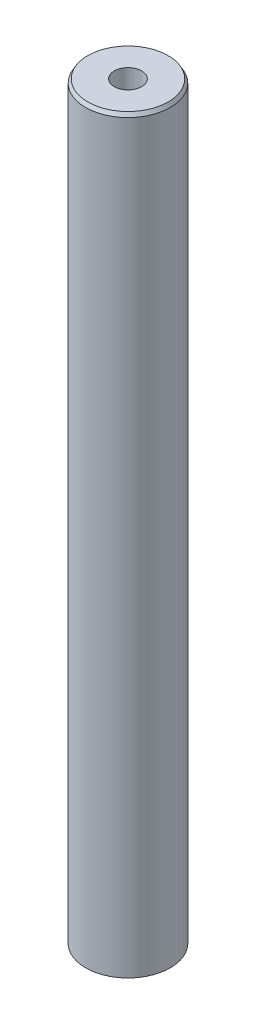
from build123d import *
from OCP.BRepFilletAPI import BRepFilletAPI_MakeChamfer

# Parameters (mm, degrees)
SKETCH1_R           = 15
BOSS_EXTRUDE1_DEPTH = 266.257905855
SKETCH2_R           = 4.851781194
CUT_EXTRUDE1_DEPTH  = 268.101614428
CHAMFER1_SIZE       = 1.319308992
CHAMFER1_SIZE2      = 0.761703401


with BuildPart() as part:
    # Sketch1 → Boss-Extrude1 (new body)
    with BuildSketch(Plane(origin=(0, 0, 0), x_dir=(1, 0, 0), z_dir=(0, 1, 0))):
        Circle(SKETCH1_R)
    extrude(amount=BOSS_EXTRUDE1_DEPTH)

    # Sketch2 → Cut-Extrude1 (cut, through all)
    with BuildSketch(Plane(origin=(0, 0, 0), x_dir=(1, 0, 0), z_dir=(0, 1, 0))):
        Circle(SKETCH2_R)
    extrude(amount=CUT_EXTRUDE1_DEPTH, mode=Mode.SUBTRACT)

    # Chamfer1: one chamfer whose edges measure the first distance from different faces: ONE call of the kernel's chamfer builder (chamfer() names one face for all edges)
    chamfer1_edges_1 = [part.edges().sort_by_distance(p)[0] for p in [
        (-15, 266.257905855, 0),
    ]]
    chamfer1_side_1 = [part.faces().sort_by_distance(p)[0] for p in [
        (-15, 133.128952927, 0),
    ]]
    chamfer1_edges_2 = [part.edges().sort_by_distance(p)[0] for p in [
        (-15, 0, 0),
    ]]
    chamfer1_side_2 = [part.faces().sort_by_distance(p)[0] for p in [
        (-14.575735931, 0, 0),
    ]]
    chamfer1 = BRepFilletAPI_MakeChamfer(part.part.solid().wrapped)
    for e in chamfer1_edges_1:
        chamfer1.Add(CHAMFER1_SIZE, CHAMFER1_SIZE2, e.wrapped, chamfer1_side_1[0].wrapped)  # the first distance lies on this face
    for e in chamfer1_edges_2:
        chamfer1.Add(CHAMFER1_SIZE, CHAMFER1_SIZE2, e.wrapped, chamfer1_side_2[0].wrapped)  # the first distance lies on this face
    add(Compound.cast(chamfer1.Shape()), mode=Mode.REPLACE)


solid = part.part
